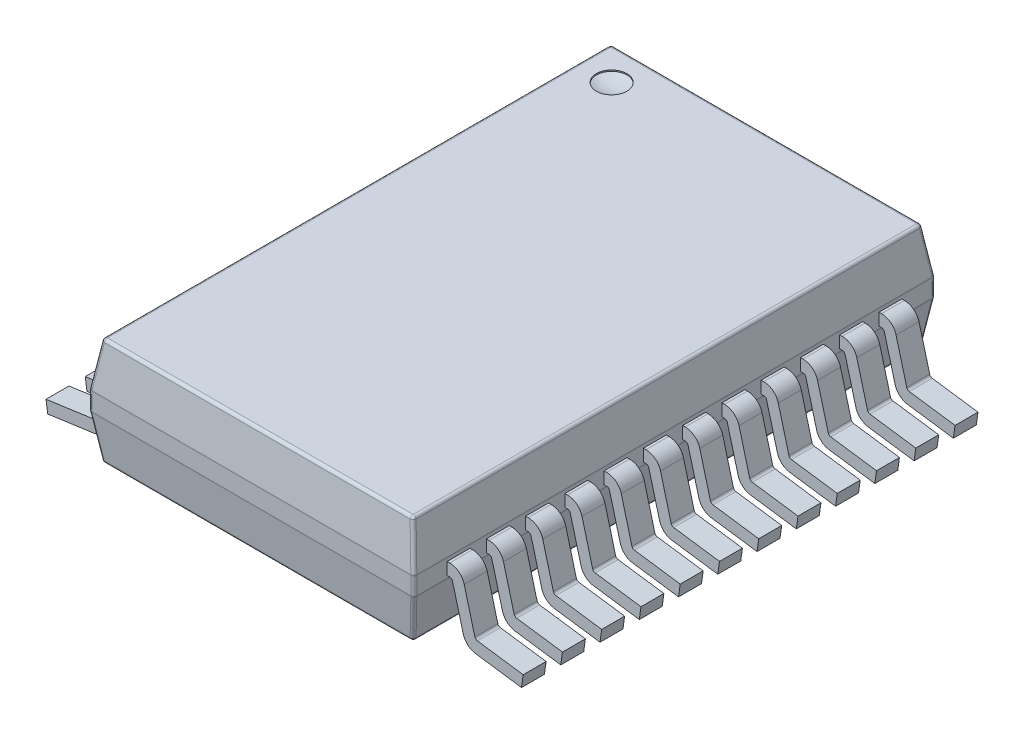
from build123d import *

# Parameters (mm, degrees)
EXTRUDE3_DEPTH      = 0.65
EXTRUDE2_DEPTH      = 0.19
LPATTERN7_COUNT     = 6
LPATTERN7_PITCH     = 0.65
MIRROR1_DEPTH       = 3.9
MIRROR1_START       = 0.135
MIRROR1_2_DEPTH     = 0.38
MIRROR1_START_2     = 0.785
MIRROR1_3_DEPTH     = 0.38
MIRROR1_START_3     = 1.435
MIRROR1_4_DEPTH     = 0.38
MIRROR1_START_4     = 2.085
MIRROR1_5_DEPTH     = 0.38
MIRROR1_START_5     = 2.735
MIRROR1_6_DEPTH     = 0.38
MIRROR1_START_6     = 3.385
MIRROR1_7_DEPTH     = 0.38
BOSS_EXTRUDE1_DEPTH = 0.415
CUT_EXTRUDE2_DEPTH  = 10
SKETCH8_R           = 0.2528244
CUT_EXTRUDE3_DEPTH  = 0.02
FILLET1_R           = 0.05


# Read off the part's stored shape, not the designer's step: Mirror1, Dome1
with BuildPart() as part:
    # Sketch3 → Extrude3 (new body)
    with BuildSketch(Plane.XY):
        Polygon((-2.69, 0.738669635), (-2.69, 1.041330365), (-2.573211952, 1.781217847), (2.573211952, 1.781217847), (2.69, 1.041330365), (2.69, 0.738669635), (2.573211952, -0.001217847), (-2.573211952, -0.001217847), align=None)
    extrude3 = extrude(amount=-EXTRUDE3_DEPTH)

    # Sketch2 → Extrude2 (add, symmetric)
    with BuildSketch(Plane.XY.offset(-0.325)):
        with BuildLine():
            Line((-3.95, -0.009679462), (-3.92216538, -0.207733076))
            Line((-3.92216538, -0.207733076), (-3.16410423, -0.101194529))
            ThreePointArc((-3.16410423, -0.101194529), (-3.033111478, -0.040750448), (-2.957325707, 0.082005834))
            Line((-2.957325707, 0.082005834), (-2.780330597, 0.746278784))
            ThreePointArc((-2.780330597, 0.746278784), (-2.762482066, 0.773051806), (-2.732016237, 0.783405454))
            Line((-2.732016237, 0.783405454), (-2.656908016, 0.783405454))
            Line((-2.656908016, 0.783405454), (-2.656908016, 0.983405454))
            Line((-2.656908016, 0.983405454), (-2.732016237, 0.983405454))
            ThreePointArc((-2.732016237, 0.983405454), (-2.884345381, 0.931637216), (-2.973588035, 0.797772108))
            Line((-2.973588035, 0.797772108), (-3.150583146, 0.133499157))
            ThreePointArc((-3.150583146, 0.133499157), (-3.1657403, 0.108947901), (-3.19193885, 0.096859085))
            Line((-3.19193885, 0.096859085), (-3.95, -0.009679462))
        make_face()
        with BuildLine():
            Line((2.973588035, 0.797772108), (3.150583146, 0.133499157))
            ThreePointArc((3.150583146, 0.133499157), (3.1657403, 0.108947901), (3.19193885, 0.096859085))
            Line((3.19193885, 0.096859085), (3.95, -0.009679462))
            Line((3.95, -0.009679462), (3.92216538, -0.207733076))
            Line((3.92216538, -0.207733076), (3.16410423, -0.101194529))
            ThreePointArc((3.16410423, -0.101194529), (3.033111478, -0.040750448), (2.957325707, 0.082005834))
            Line((2.957325707, 0.082005834), (2.780330597, 0.746278784))
            ThreePointArc((2.780330597, 0.746278784), (2.762482066, 0.773051806), (2.732016237, 0.783405454))
            Line((2.732016237, 0.783405454), (2.656908016, 0.783405454))
            Line((2.656908016, 0.783405454), (2.656908016, 0.983405454))
            Line((2.656908016, 0.983405454), (2.732016237, 0.983405454))
            ThreePointArc((2.732016237, 0.983405454), (2.884345381, 0.931637216), (2.973588035, 0.797772108))
        make_face()
    extrude2 = extrude(amount=EXTRUDE2_DEPTH, both=True)

    # LPattern7: Extrude3, Extrude2 ×6
    with Locations(*[(0, 0, -i * LPATTERN7_PITCH) for i in range(1, LPATTERN7_COUNT)]):
        add(extrude3)
        add(extrude2)

    # Mirror1 outline → Mirror1 (add)
    with BuildSketch(Plane.XY):
        Polygon((-2.69, 1.041330365), (-2.69, 0.738669635), (-2.573211952, -0.001217847), (2.573211952, -0.001217847), (2.69, 0.738669635), (2.69, 1.041330365), (2.573211952, 1.781217847), (-2.573211952, 1.781217847), align=None)
    extrude(amount=MIRROR1_DEPTH)

    # Mirror1 2 outline → Mirror1 2 (add)
    with BuildSketch(Plane.XY.offset(MIRROR1_START)):
        with BuildLine():
            Line((-2.732016237, 0.783405454), (-2.69, 0.783405454))
            Line((-2.69, 0.783405454), (-2.69, 0.983405454))
            Line((-2.69, 0.983405454), (-2.732016237, 0.983405454))
            ThreePointArc((-2.732016237, 0.983405454), (-2.884345381, 0.931637216), (-2.973588035, 0.797772108))
            Line((-2.973588035, 0.797772108), (-3.150583146, 0.133499157))
            ThreePointArc((-3.150583146, 0.133499157), (-3.1657403, 0.108947901), (-3.19193885, 0.096859085))
            Line((-3.19193885, 0.096859085), (-3.95, -0.009679462))
            Line((-3.95, -0.009679462), (-3.92216538, -0.207733076))
            Line((-3.92216538, -0.207733076), (-3.16410423, -0.101194529))
            ThreePointArc((-3.16410423, -0.101194529), (-3.033111478, -0.040750448), (-2.957325707, 0.082005834))
            Line((-2.957325707, 0.082005834), (-2.780330597, 0.746278784))
            ThreePointArc((-2.780330597, 0.746278784), (-2.762482066, 0.773051806), (-2.732016237, 0.783405454))
        make_face()
        with BuildLine():
            Line((2.69, 0.983405454), (2.69, 0.783405454))
            Line((2.69, 0.783405454), (2.732016237, 0.783405454))
            ThreePointArc((2.732016237, 0.783405454), (2.762482066, 0.773051806), (2.780330597, 0.746278784))
            Line((2.780330597, 0.746278784), (2.957325707, 0.082005834))
            ThreePointArc((2.957325707, 0.082005834), (3.033111478, -0.040750448), (3.16410423, -0.101194529))
            Line((3.16410423, -0.101194529), (3.92216538, -0.207733076))
            Line((3.92216538, -0.207733076), (3.95, -0.009679462))
            Line((3.95, -0.009679462), (3.19193885, 0.096859085))
            ThreePointArc((3.19193885, 0.096859085), (3.1657403, 0.108947901), (3.150583146, 0.133499157))
            Line((3.150583146, 0.133499157), (2.973588035, 0.797772108))
            ThreePointArc((2.973588035, 0.797772108), (2.884345381, 0.931637216), (2.732016237, 0.983405454))
            Line((2.732016237, 0.983405454), (2.69, 0.983405454))
        make_face()
    extrude(amount=MIRROR1_2_DEPTH)

    # Mirror1 3 outline → Mirror1 3 (add)
    with BuildSketch(Plane.XY.offset(MIRROR1_START_2)):
        with BuildLine():
            Line((-2.732016237, 0.783405454), (-2.69, 0.783405454))
            Line((-2.69, 0.783405454), (-2.69, 0.983405454))
            Line((-2.69, 0.983405454), (-2.732016237, 0.983405454))
            ThreePointArc((-2.732016237, 0.983405454), (-2.884345381, 0.931637216), (-2.973588035, 0.797772108))
            Line((-2.973588035, 0.797772108), (-3.150583146, 0.133499157))
            ThreePointArc((-3.150583146, 0.133499157), (-3.1657403, 0.108947901), (-3.19193885, 0.096859085))
            Line((-3.19193885, 0.096859085), (-3.95, -0.009679462))
            Line((-3.95, -0.009679462), (-3.92216538, -0.207733076))
            Line((-3.92216538, -0.207733076), (-3.16410423, -0.101194529))
            ThreePointArc((-3.16410423, -0.101194529), (-3.033111478, -0.040750448), (-2.957325707, 0.082005834))
            Line((-2.957325707, 0.082005834), (-2.780330597, 0.746278784))
            ThreePointArc((-2.780330597, 0.746278784), (-2.762482066, 0.773051806), (-2.732016237, 0.783405454))
        make_face()
        with BuildLine():
            Line((2.69, 0.983405454), (2.69, 0.783405454))
            Line((2.69, 0.783405454), (2.732016237, 0.783405454))
            ThreePointArc((2.732016237, 0.783405454), (2.762482066, 0.773051806), (2.780330597, 0.746278784))
            Line((2.780330597, 0.746278784), (2.957325707, 0.082005834))
            ThreePointArc((2.957325707, 0.082005834), (3.033111478, -0.040750448), (3.16410423, -0.101194529))
            Line((3.16410423, -0.101194529), (3.92216538, -0.207733076))
            Line((3.92216538, -0.207733076), (3.95, -0.009679462))
            Line((3.95, -0.009679462), (3.19193885, 0.096859085))
            ThreePointArc((3.19193885, 0.096859085), (3.1657403, 0.108947901), (3.150583146, 0.133499157))
            Line((3.150583146, 0.133499157), (2.973588035, 0.797772108))
            ThreePointArc((2.973588035, 0.797772108), (2.884345381, 0.931637216), (2.732016237, 0.983405454))
            Line((2.732016237, 0.983405454), (2.69, 0.983405454))
        make_face()
    extrude(amount=MIRROR1_3_DEPTH)

    # Mirror1 4 outline → Mirror1 4 (add)
    with BuildSketch(Plane.XY.offset(MIRROR1_START_3)):
        with BuildLine():
            Line((-2.732016237, 0.783405454), (-2.69, 0.783405454))
            Line((-2.69, 0.783405454), (-2.69, 0.983405454))
            Line((-2.69, 0.983405454), (-2.732016237, 0.983405454))
            ThreePointArc((-2.732016237, 0.983405454), (-2.884345381, 0.931637216), (-2.973588035, 0.797772108))
            Line((-2.973588035, 0.797772108), (-3.150583146, 0.133499157))
            ThreePointArc((-3.150583146, 0.133499157), (-3.1657403, 0.108947901), (-3.19193885, 0.096859085))
            Line((-3.19193885, 0.096859085), (-3.95, -0.009679462))
            Line((-3.95, -0.009679462), (-3.92216538, -0.207733076))
            Line((-3.92216538, -0.207733076), (-3.16410423, -0.101194529))
            ThreePointArc((-3.16410423, -0.101194529), (-3.033111478, -0.040750448), (-2.957325707, 0.082005834))
            Line((-2.957325707, 0.082005834), (-2.780330597, 0.746278784))
            ThreePointArc((-2.780330597, 0.746278784), (-2.762482066, 0.773051806), (-2.732016237, 0.783405454))
        make_face()
        with BuildLine():
            Line((2.69, 0.983405454), (2.69, 0.783405454))
            Line((2.69, 0.783405454), (2.732016237, 0.783405454))
            ThreePointArc((2.732016237, 0.783405454), (2.762482066, 0.773051806), (2.780330597, 0.746278784))
            Line((2.780330597, 0.746278784), (2.957325707, 0.082005834))
            ThreePointArc((2.957325707, 0.082005834), (3.033111478, -0.040750448), (3.16410423, -0.101194529))
            Line((3.16410423, -0.101194529), (3.92216538, -0.207733076))
            Line((3.92216538, -0.207733076), (3.95, -0.009679462))
            Line((3.95, -0.009679462), (3.19193885, 0.096859085))
            ThreePointArc((3.19193885, 0.096859085), (3.1657403, 0.108947901), (3.150583146, 0.133499157))
            Line((3.150583146, 0.133499157), (2.973588035, 0.797772108))
            ThreePointArc((2.973588035, 0.797772108), (2.884345381, 0.931637216), (2.732016237, 0.983405454))
            Line((2.732016237, 0.983405454), (2.69, 0.983405454))
        make_face()
    extrude(amount=MIRROR1_4_DEPTH)

    # Mirror1 5 outline → Mirror1 5 (add)
    with BuildSketch(Plane.XY.offset(MIRROR1_START_4)):
        with BuildLine():
            Line((-2.732016237, 0.783405454), (-2.69, 0.783405454))
            Line((-2.69, 0.783405454), (-2.69, 0.983405454))
            Line((-2.69, 0.983405454), (-2.732016237, 0.983405454))
            ThreePointArc((-2.732016237, 0.983405454), (-2.884345381, 0.931637216), (-2.973588035, 0.797772108))
            Line((-2.973588035, 0.797772108), (-3.150583146, 0.133499157))
            ThreePointArc((-3.150583146, 0.133499157), (-3.1657403, 0.108947901), (-3.19193885, 0.096859085))
            Line((-3.19193885, 0.096859085), (-3.95, -0.009679462))
            Line((-3.95, -0.009679462), (-3.92216538, -0.207733076))
            Line((-3.92216538, -0.207733076), (-3.16410423, -0.101194529))
            ThreePointArc((-3.16410423, -0.101194529), (-3.033111478, -0.040750448), (-2.957325707, 0.082005834))
            Line((-2.957325707, 0.082005834), (-2.780330597, 0.746278784))
            ThreePointArc((-2.780330597, 0.746278784), (-2.762482066, 0.773051806), (-2.732016237, 0.783405454))
        make_face()
        with BuildLine():
            Line((2.69, 0.983405454), (2.69, 0.783405454))
            Line((2.69, 0.783405454), (2.732016237, 0.783405454))
            ThreePointArc((2.732016237, 0.783405454), (2.762482066, 0.773051806), (2.780330597, 0.746278784))
            Line((2.780330597, 0.746278784), (2.957325707, 0.082005834))
            ThreePointArc((2.957325707, 0.082005834), (3.033111478, -0.040750448), (3.16410423, -0.101194529))
            Line((3.16410423, -0.101194529), (3.92216538, -0.207733076))
            Line((3.92216538, -0.207733076), (3.95, -0.009679462))
            Line((3.95, -0.009679462), (3.19193885, 0.096859085))
            ThreePointArc((3.19193885, 0.096859085), (3.1657403, 0.108947901), (3.150583146, 0.133499157))
            Line((3.150583146, 0.133499157), (2.973588035, 0.797772108))
            ThreePointArc((2.973588035, 0.797772108), (2.884345381, 0.931637216), (2.732016237, 0.983405454))
            Line((2.732016237, 0.983405454), (2.69, 0.983405454))
        make_face()
    extrude(amount=MIRROR1_5_DEPTH)

    # Mirror1 6 outline → Mirror1 6 (add)
    with BuildSketch(Plane.XY.offset(MIRROR1_START_5)):
        with BuildLine():
            Line((-2.732016237, 0.783405454), (-2.69, 0.783405454))
            Line((-2.69, 0.783405454), (-2.69, 0.983405454))
            Line((-2.69, 0.983405454), (-2.732016237, 0.983405454))
            ThreePointArc((-2.732016237, 0.983405454), (-2.884345381, 0.931637216), (-2.973588035, 0.797772108))
            Line((-2.973588035, 0.797772108), (-3.150583146, 0.133499157))
            ThreePointArc((-3.150583146, 0.133499157), (-3.1657403, 0.108947901), (-3.19193885, 0.096859085))
            Line((-3.19193885, 0.096859085), (-3.95, -0.009679462))
            Line((-3.95, -0.009679462), (-3.92216538, -0.207733076))
            Line((-3.92216538, -0.207733076), (-3.16410423, -0.101194529))
            ThreePointArc((-3.16410423, -0.101194529), (-3.033111478, -0.040750448), (-2.957325707, 0.082005834))
            Line((-2.957325707, 0.082005834), (-2.780330597, 0.746278784))
            ThreePointArc((-2.780330597, 0.746278784), (-2.762482066, 0.773051806), (-2.732016237, 0.783405454))
        make_face()
        with BuildLine():
            Line((2.69, 0.983405454), (2.69, 0.783405454))
            Line((2.69, 0.783405454), (2.732016237, 0.783405454))
            ThreePointArc((2.732016237, 0.783405454), (2.762482066, 0.773051806), (2.780330597, 0.746278784))
            Line((2.780330597, 0.746278784), (2.957325707, 0.082005834))
            ThreePointArc((2.957325707, 0.082005834), (3.033111478, -0.040750448), (3.16410423, -0.101194529))
            Line((3.16410423, -0.101194529), (3.92216538, -0.207733076))
            Line((3.92216538, -0.207733076), (3.95, -0.009679462))
            Line((3.95, -0.009679462), (3.19193885, 0.096859085))
            ThreePointArc((3.19193885, 0.096859085), (3.1657403, 0.108947901), (3.150583146, 0.133499157))
            Line((3.150583146, 0.133499157), (2.973588035, 0.797772108))
            ThreePointArc((2.973588035, 0.797772108), (2.884345381, 0.931637216), (2.732016237, 0.983405454))
            Line((2.732016237, 0.983405454), (2.69, 0.983405454))
        make_face()
    extrude(amount=MIRROR1_6_DEPTH)

    # Mirror1 7 outline → Mirror1 7 (add)
    with BuildSketch(Plane.XY.offset(MIRROR1_START_6)):
        with BuildLine():
            Line((-2.732016237, 0.783405454), (-2.69, 0.783405454))
            Line((-2.69, 0.783405454), (-2.69, 0.983405454))
            Line((-2.69, 0.983405454), (-2.732016237, 0.983405454))
            ThreePointArc((-2.732016237, 0.983405454), (-2.884345381, 0.931637216), (-2.973588035, 0.797772108))
            Line((-2.973588035, 0.797772108), (-3.150583146, 0.133499157))
            ThreePointArc((-3.150583146, 0.133499157), (-3.1657403, 0.108947901), (-3.19193885, 0.096859085))
            Line((-3.19193885, 0.096859085), (-3.95, -0.009679462))
            Line((-3.95, -0.009679462), (-3.92216538, -0.207733076))
            Line((-3.92216538, -0.207733076), (-3.16410423, -0.101194529))
            ThreePointArc((-3.16410423, -0.101194529), (-3.033111478, -0.040750448), (-2.957325707, 0.082005834))
            Line((-2.957325707, 0.082005834), (-2.780330597, 0.746278784))
            ThreePointArc((-2.780330597, 0.746278784), (-2.762482066, 0.773051806), (-2.732016237, 0.783405454))
        make_face()
        with BuildLine():
            Line((2.69, 0.983405454), (2.69, 0.783405454))
            Line((2.69, 0.783405454), (2.732016237, 0.783405454))
            ThreePointArc((2.732016237, 0.783405454), (2.762482066, 0.773051806), (2.780330597, 0.746278784))
            Line((2.780330597, 0.746278784), (2.957325707, 0.082005834))
            ThreePointArc((2.957325707, 0.082005834), (3.033111478, -0.040750448), (3.16410423, -0.101194529))
            Line((3.16410423, -0.101194529), (3.92216538, -0.207733076))
            Line((3.92216538, -0.207733076), (3.95, -0.009679462))
            Line((3.95, -0.009679462), (3.19193885, 0.096859085))
            ThreePointArc((3.19193885, 0.096859085), (3.1657403, 0.108947901), (3.150583146, 0.133499157))
            Line((3.150583146, 0.133499157), (2.973588035, 0.797772108))
            ThreePointArc((2.973588035, 0.797772108), (2.884345381, 0.931637216), (2.732016237, 0.983405454))
            Line((2.732016237, 0.983405454), (2.69, 0.983405454))
        make_face()
    extrude(amount=MIRROR1_7_DEPTH)

    # Sketch9 → Boss-Extrude1 (add)
    with BuildSketch(Plane(origin=(0, 0, -3.9), x_dir=(-1, 0, 0), z_dir=(0, 0, -1))):
        Polygon((2.573211952, -0.001217847), (2.69, 0.738669635), (2.69, 1.041330365), (2.573211952, 1.781217847), (-2.573211952, 1.781217847), (-2.69, 1.041330365), (-2.69, 0.738669635), (-2.573211952, -0.001217847), align=None)
    boss_extrude1 = extrude(amount=BOSS_EXTRUDE1_DEPTH)

    # Mirror2: Boss-Extrude1 across plane
    add(boss_extrude1.mirror(Plane.XY))

    # Sketch7 → Cut-Extrude2 (cut)
    with BuildSketch(Plane(origin=(2.69, 0, 0), x_dir=(0, 0, -1), z_dir=(1, 0, 0))):
        Polygon((-4.315, 0.738669635), (-4.315, -0.001217847), (-4.210903857, -0.001217847), align=None)
        Polygon((4.315, 1.041330365), (4.315, 1.781217847), (4.210903857, 1.781217847), align=None)
        Polygon((-4.210903857, 1.781217847), (-4.315, 1.041330365), (-4.315, 1.781217847), align=None)
        Polygon((4.210903857, -0.001217847), (4.315, 0.738669635), (4.315, -0.001217847), align=None)
    extrude(amount=-CUT_EXTRUDE2_DEPTH, mode=Mode.SUBTRACT)

    # Sketch8 → Cut-Extrude3 (cut)
    with BuildSketch(Plane(origin=(0, 1.781217847, 0), x_dir=(1, 0, 0), z_dir=(0, 1, 0))):
        with Locations(Location((-2.019059292, 3.668802361, 0), (0, 0, 180))):
            Circle(SKETCH8_R)
    extrude(amount=-CUT_EXTRUDE3_DEPTH, mode=Mode.SUBTRACT)

    # Dome1 outline → Dome1 (revolve, cut)
    with BuildSketch(Plane(origin=(-2.019059292, 0, -3.668802361), x_dir=(1, 0, 0), z_dir=(0, 0, 1))):
        with BuildLine():
            Line((0, 1.761217847), (0, 1.711217847))
            ThreePointArc((0, 1.711217847), (0.128860562, 1.723837737), (0.252824401, 1.761217847))
            Line((0.252824401, 1.761217847), (0, 1.761217847))
        make_face()
    revolve(axis=Axis((-2.019059292, 0, -3.668802361), (0, 1, 0)), mode=Mode.SUBTRACT)

    # Fillet1
    fillet1_edges = [part.edges().sort_by_distance(p)[0] for p in [
        (-2.69, 0.738669635, -2.1575),
        (-2.69, 1.041330365, -2.1575),
        (2.69, 1.041330365, -2.1575),
        (2.69, 0.738669635, -2.1575),
        (-2.69, 0.89, -4.315),
        (2.69, 0.89, -4.315),
        (2.69, 0.89, 4.315),
        (-2.69, 0.89, 4.315),
        (0, 1.041330365, -4.315),
        (2.573211952, 1.781217847, -2.105451929),
        (-2.573211952, 1.781217847, -2.105451929),
        (-2.631605976, 1.411274106, -4.262951929),
        (2.631605976, 1.411274106, -4.262951929),
        (0, 1.781217847, -4.210903857),
        (0, 0.738669635, 4.315),
        (-2.631605976, 0.368725894, 4.262951929),
        (2.631605976, 0.368725894, 4.262951929),
        (0, -0.001217847, 4.210903857),
        (0, 1.041330365, 4.315),
        (-2.631605976, 1.411274106, 4.262951929),
        (2.631605976, 1.411274106, 4.262951929),
        (0, 1.781217847, 4.210903857),
        (0, 0.738669635, -4.315),
        (-2.573211952, -0.001217847, -2.105451929),
        (2.573211952, -0.001217847, -2.105451929),
        (-2.631605976, 0.368725894, -4.262951929),
        (2.631605976, 0.368725894, -4.262951929),
        (0, -0.001217847, -4.210903857),
    ]]
    fillet(fillet1_edges, radius=FILLET1_R)


solid = part.part
